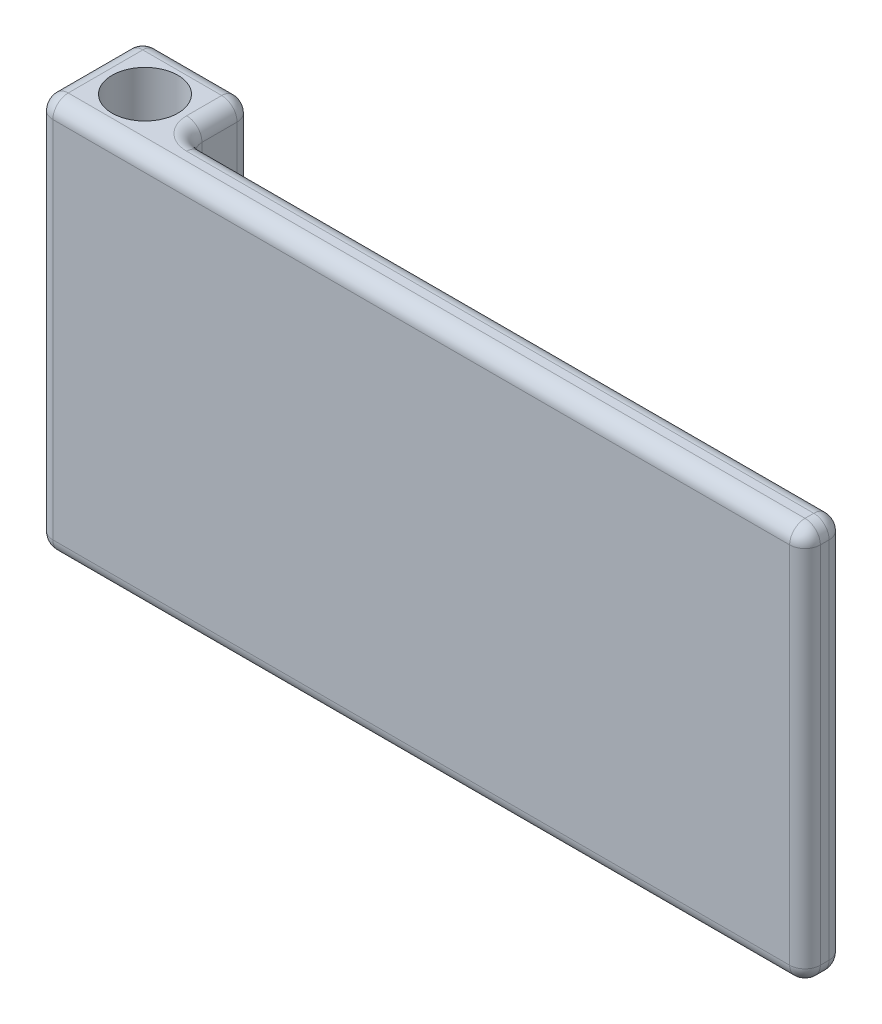
from build123d import *

# Parameters (mm, degrees)
RESSALTO_EXTRUS_O1_DEPTH      = 12
RESSALTO_EXTRUS_O1_DEPTH_BACK = 12
ESBO_O1_W                     = 175
ESBO_O1_H                     = 90
CORTE_EXTRUS_O1_DEPTH         = 198.15222545
CORTE_EXTRUS_O1_DEPTH_BACK    = 198.15222545
ESBO_O3_W                     = 150
ESBO_O3_H                     = 15
CORTE_EXTRUS_O2_DEPTH         = 198.15222545
CORTE_EXTRUS_O2_DEPTH_BACK    = 198.15222545
ESBO_O4_R                     = 7.5
FILETE1_R                     = 3.5
FILETE2_R                     = 3.5
FILETE3_R                     = 3.5


with BuildPart() as part:
    # Esboço1 → Ressalto-extrusão1 (new, two sides: drawn at the far end of the back side and taken through both)
    with BuildSketch(Plane.XY.offset(-RESSALTO_EXTRUS_O1_DEPTH_BACK)):
        with Locations((87.5, 45)):
            Rectangle(ESBO_O1_W, ESBO_O1_H)
    extrude(amount=RESSALTO_EXTRUS_O1_DEPTH + RESSALTO_EXTRUS_O1_DEPTH_BACK)

    # Esboço3 → Corte-extrusão1 (cut, two sides: drawn at the far end of the back side and taken through both)
    with BuildSketch(Plane(origin=(0, 0, 0), x_dir=(1, 0, 0), z_dir=(0, 1, 0)).offset(-CORTE_EXTRUS_O1_DEPTH_BACK)):
        with Locations((100, 4.5)):
            Rectangle(ESBO_O3_W, ESBO_O3_H)
    extrude(amount=CORTE_EXTRUS_O1_DEPTH + CORTE_EXTRUS_O1_DEPTH_BACK, mode=Mode.SUBTRACT)

    # Esboço4 → Corte-extrusão2 (cut, two sides: drawn at the far end of the back side and taken through both)
    with BuildSketch(Plane(origin=(0, 90, 0), x_dir=(1, 0, 0), z_dir=(0, 1, 0)).offset(-CORTE_EXTRUS_O2_DEPTH_BACK)):
        with Locations(Location((12.5, 0, 0), (0, 0, 270))):
            Circle(ESBO_O4_R)
    extrude(amount=CORTE_EXTRUS_O2_DEPTH + CORTE_EXTRUS_O2_DEPTH_BACK, mode=Mode.SUBTRACT)

    # Filete1
    filete1_edges = [part.edges().sort_by_distance(p)[0] for p in [
        (25, 45, -12),
        (25, 45, 3),
        (0, 45, -12),
    ]]
    fillet(filete1_edges, radius=FILETE1_R)

    # Filete2
    filete2_edges = [part.edges().sort_by_distance(p)[0] for p in [
        (175, 45, 12),
        (87.5, 90, 12),
        (175, 45, 3),
    ]]
    fillet(filete2_edges, radius=FILETE2_R)

    # Filete3
    # the kernel refuses this fillet: 3.5 mm, written as the material it takes off along each edge
    with BuildSketch(Plane(origin=(171.5, 86.5, 8.5), x_dir=(0, 1, 0), z_dir=(1, 0, 0))) as filete3_piece_1_section:
        Polygon((0, 0), (FILETE3_R, 0), (FILETE3_R, FILETE3_R), (0, FILETE3_R), align=None)
    filete3_piece_1 = extrude(amount=FILETE3_R, mode=Mode.PRIVATE)
    filete3_piece_1 = filete3_piece_1 - Plane(origin=(171.5, 86.5, 8.5), x_dir=(0, -0.7071067811865475, -0.7071067811865475), z_dir=(1, 0, 0)) * Sphere(FILETE3_R, mode=Mode.PRIVATE)
    add(filete3_piece_1, mode=Mode.SUBTRACT)
    with BuildSketch(Plane(origin=(3.5, 3.5, 8.5), x_dir=(0, 0, 1), z_dir=(0, -1, 0))) as filete3_piece_2_section:
        Polygon((0, 0), (FILETE3_R, 0), (FILETE3_R, FILETE3_R), (0, FILETE3_R), align=None)
    filete3_piece_2 = extrude(amount=FILETE3_R, mode=Mode.PRIVATE)
    filete3_piece_2 = filete3_piece_2 - Plane(origin=(3.5, 3.5, 8.5), x_dir=(0.7071067811865475, 0, -0.7071067811865475), z_dir=(0, -1, 0)) * Sphere(FILETE3_R, mode=Mode.PRIVATE)
    add(filete3_piece_2, mode=Mode.SUBTRACT)
    with BuildSketch(Plane(origin=(3.5, 0, 12), x_dir=(0, 0, -1), z_dir=(1, 0, 0))) as filete3_piece_3:
        with BuildLine():
            CenterArc((FILETE3_R, FILETE3_R), FILETE3_R, 180, 90)
            Line((0, FILETE3_R), (0, 0))
            Line((0, 0), (FILETE3_R, 0))
        make_face()
    extrude(amount=168, mode=Mode.SUBTRACT)
    with BuildSketch(Plane(origin=(0, 0, 8.5), x_dir=(1, 0, 0), z_dir=(0, 0, -1)), Plane(origin=(0, 90, 8.5), x_dir=(0, -1, 0), z_dir=(0, 0, -1))) as filete3_piece_4:
        with BuildLine():
            CenterArc((FILETE3_R, -FILETE3_R), FILETE3_R, 90, 90)
            Line((0, -FILETE3_R), (0, 0))
            Line((0, 0), (FILETE3_R, 0))
        make_face()
    extrude(amount=17, mode=Mode.SUBTRACT)
    with BuildSketch(Plane(origin=(25, 0, -8.5), x_dir=(-1, 0, 0), z_dir=(0, 0, 1))) as filete3_piece_5:
        with BuildLine():
            CenterArc((FILETE3_R, -FILETE3_R), FILETE3_R, 90, 90)
            Line((0, -FILETE3_R), (0, 0))
            Line((0, 0), (FILETE3_R, 0))
        make_face()
    extrude(amount=8, mode=Mode.SUBTRACT)
    with BuildSketch(Plane(origin=(3.5, 0, -12), x_dir=(0, 0, 1), z_dir=(1, 0, 0))) as filete3_piece_6:
        with BuildLine():
            CenterArc((FILETE3_R, -FILETE3_R), FILETE3_R, 90, 90)
            Line((0, -FILETE3_R), (0, 0))
            Line((0, 0), (FILETE3_R, 0))
        make_face()
    extrude(amount=18, mode=Mode.SUBTRACT)
    with BuildSketch(Plane(origin=(21.5, 0, -8.5), x_dir=(0, 0, -1), z_dir=(-1, 0, 0))) as filete3_piece_7:
        with BuildLine():
            CenterArc((3.5 - FILETE3_R, -FILETE3_R), FILETE3_R, 0, 90)
            Line((3.5, -FILETE3_R), (3.5, 0))
            Line((3.5, 0), (3.5 - FILETE3_R, 0))
        make_face()
    revolve(axis=Axis((21.5, 0, -8.5), (0, -1, 0)), revolution_arc=90, mode=Mode.SUBTRACT)
    with BuildSketch(Plane(origin=(3.5, 0, -8.5), x_dir=(-1, 0, 0), z_dir=(0, 0, 1))) as filete3_piece_8:
        with BuildLine():
            CenterArc((3.5 - FILETE3_R, -FILETE3_R), FILETE3_R, 0, 90)
            Line((3.5, -FILETE3_R), (3.5, 0))
            Line((3.5, 0), (3.5 - FILETE3_R, 0))
        make_face()
    revolve(axis=Axis((3.5, 0, -8.5), (0, -1, 0)), revolution_arc=90, mode=Mode.SUBTRACT)
    with BuildSketch(Plane(origin=(21.5, 90, -12), x_dir=(0, -1, 0), z_dir=(-1, 0, 0))) as filete3_piece_9:
        with BuildLine():
            CenterArc((FILETE3_R, FILETE3_R), FILETE3_R, 180, 90)
            Line((0, FILETE3_R), (0, 0))
            Line((0, 0), (FILETE3_R, 0))
        make_face()
    extrude(amount=18, mode=Mode.SUBTRACT)
    with BuildSketch(Plane(origin=(25, 90, -0.5), x_dir=(0, -1, 0), z_dir=(0, 0, -1))) as filete3_piece_10:
        with BuildLine():
            CenterArc((FILETE3_R, FILETE3_R), FILETE3_R, 180, 90)
            Line((0, FILETE3_R), (0, 0))
            Line((0, 0), (FILETE3_R, 0))
        make_face()
    extrude(amount=8, mode=Mode.SUBTRACT)
    with BuildSketch(Plane(origin=(171.5, 90, 3), x_dir=(0, -1, 0), z_dir=(-1, 0, 0))) as filete3_piece_11:
        with BuildLine():
            CenterArc((FILETE3_R, FILETE3_R), FILETE3_R, 180, 90)
            Line((0, FILETE3_R), (0, 0))
            Line((0, 0), (FILETE3_R, 0))
        make_face()
    extrude(amount=143, mode=Mode.SUBTRACT)
    with BuildSketch(Plane(origin=(21.5, 90, -8.5), x_dir=(0, 0, -1), z_dir=(-1, 0, 0))) as filete3_piece_12:
        with BuildLine():
            CenterArc((3.5 - FILETE3_R, FILETE3_R), FILETE3_R, 270, 90)
            Line((3.5 - FILETE3_R, 0), (3.5, 0))
            Line((3.5, 0), (3.5, FILETE3_R))
        make_face()
    revolve(axis=Axis((21.5, 90, -8.5), (0, -1, 0)), revolution_arc=90, mode=Mode.SUBTRACT)
    with BuildSketch(Plane(origin=(3.5, 90, -8.5), x_dir=(-1, 0, 0), z_dir=(0, 0, 1))) as filete3_piece_13:
        with BuildLine():
            CenterArc((3.5 - FILETE3_R, FILETE3_R), FILETE3_R, 270, 90)
            Line((3.5 - FILETE3_R, 0), (3.5, 0))
            Line((3.5, 0), (3.5, FILETE3_R))
        make_face()
    revolve(axis=Axis((3.5, 90, -8.5), (0, -1, 0)), revolution_arc=90, mode=Mode.SUBTRACT)
    with BuildSketch(Plane(origin=(28.5, 90, -0.5), x_dir=(-1, 0, 0), z_dir=(0, 0, -1))) as filete3_piece_14:
        with BuildLine():
            CenterArc((3.5 + FILETE3_R, -FILETE3_R), FILETE3_R, 90, 90)
            Line((3.5 + FILETE3_R, 0), (3.5, 0))
            Line((3.5, 0), (3.5, -FILETE3_R))
        make_face()
    revolve(axis=Axis((28.5, 90, -0.5), (0, 1, 0)), revolution_arc=90, mode=Mode.SUBTRACT)
    with BuildSketch(Plane(origin=(28.5, 0, -0.5), x_dir=(-1, 0, 0), z_dir=(0, 0, -1))) as filete3_piece_15:
        with BuildLine():
            CenterArc((3.5 + FILETE3_R, FILETE3_R), FILETE3_R, 180, 90)
            Line((3.5, FILETE3_R), (3.5, 0))
            Line((3.5, 0), (3.5 + FILETE3_R, 0))
        make_face()
    revolve(axis=Axis((28.5, 0, -0.5), (0, 1, 0)), revolution_arc=90, mode=Mode.SUBTRACT)
    with BuildSketch(Plane(origin=(0, 86.5, 12), x_dir=(1, 0, 0), z_dir=(0, -1, 0))) as filete3_piece_16:
        with BuildLine():
            CenterArc((FILETE3_R, -FILETE3_R), FILETE3_R, 90, 90)
            Line((0, -FILETE3_R), (0, 0))
            Line((0, 0), (FILETE3_R, 0))
        make_face()
    extrude(amount=83, mode=Mode.SUBTRACT)
    with BuildSketch(Plane(origin=(0, 86.5, 8.5), x_dir=(0, 0, 1), z_dir=(0, -1, 0))) as filete3_piece_17:
        with BuildLine():
            CenterArc((3.5 - FILETE3_R, -FILETE3_R), FILETE3_R, 0, 90)
            Line((3.5, -FILETE3_R), (3.5, 0))
            Line((3.5, 0), (3.5 - FILETE3_R, 0))
        make_face()
    revolve(axis=Axis((0, 86.5, 8.5), (-1, 0, 0)), revolution_arc=90, mode=Mode.SUBTRACT)
    with BuildSketch(Plane(origin=(175, 90, 6.5), x_dir=(0, -1, 0), z_dir=(0, 0, 1)), Plane(origin=(175, 0, 6.5), x_dir=(-1, 0, 0), z_dir=(0, 0, 1))) as filete3_piece_18:
        with BuildLine():
            CenterArc((FILETE3_R, -FILETE3_R), FILETE3_R, 90, 90)
            Line((0, -FILETE3_R), (0, 0))
            Line((0, 0), (FILETE3_R, 0))
        make_face()
    extrude(amount=2, mode=Mode.SUBTRACT)
    with BuildSketch(Plane(origin=(171.5, 90, 6.5), x_dir=(1, 0, 0), z_dir=(0, 0, 1))) as filete3_piece_19:
        with BuildLine():
            CenterArc((3.5 - FILETE3_R, -FILETE3_R), FILETE3_R, 0, 90)
            Line((3.5 - FILETE3_R, 0), (3.5, 0))
            Line((3.5, 0), (3.5, -FILETE3_R))
        make_face()
    revolve(axis=Axis((171.5, 90, 6.5), (0, 1, 0)), revolution_arc=90, mode=Mode.SUBTRACT)
    with BuildSketch(Plane(origin=(28.5, 0, 3), x_dir=(0, 0, 1), z_dir=(1, 0, 0))) as filete3_piece_20:
        with BuildLine():
            CenterArc((FILETE3_R, -FILETE3_R), FILETE3_R, 90, 90)
            Line((0, -FILETE3_R), (0, 0))
            Line((0, 0), (FILETE3_R, 0))
        make_face()
    extrude(amount=143, mode=Mode.SUBTRACT)
    with BuildSketch(Plane(origin=(171.5, 0, 6.5), x_dir=(1, 0, 0), z_dir=(0, 0, 1))) as filete3_piece_21:
        with BuildLine():
            CenterArc((3.5 - FILETE3_R, FILETE3_R), FILETE3_R, 270, 90)
            Line((3.5, FILETE3_R), (3.5, 0))
            Line((3.5, 0), (3.5 - FILETE3_R, 0))
        make_face()
    revolve(axis=Axis((171.5, 0, 6.5), (0, 1, 0)), revolution_arc=90, mode=Mode.SUBTRACT)
    with BuildSketch(Plane(origin=(171.5, 0, 8.5), x_dir=(0, 0, 1), z_dir=(-1, 0, 0))) as filete3_piece_22:
        with BuildLine():
            CenterArc((3.5 - FILETE3_R, FILETE3_R), FILETE3_R, 270, 90)
            Line((3.5, FILETE3_R), (3.5, 0))
            Line((3.5, 0), (3.5 - FILETE3_R, 0))
        make_face()
    revolve(axis=Axis((171.5, 0, 8.5), (0, 1, 0)), revolution_arc=90, mode=Mode.SUBTRACT)


solid = part.part
